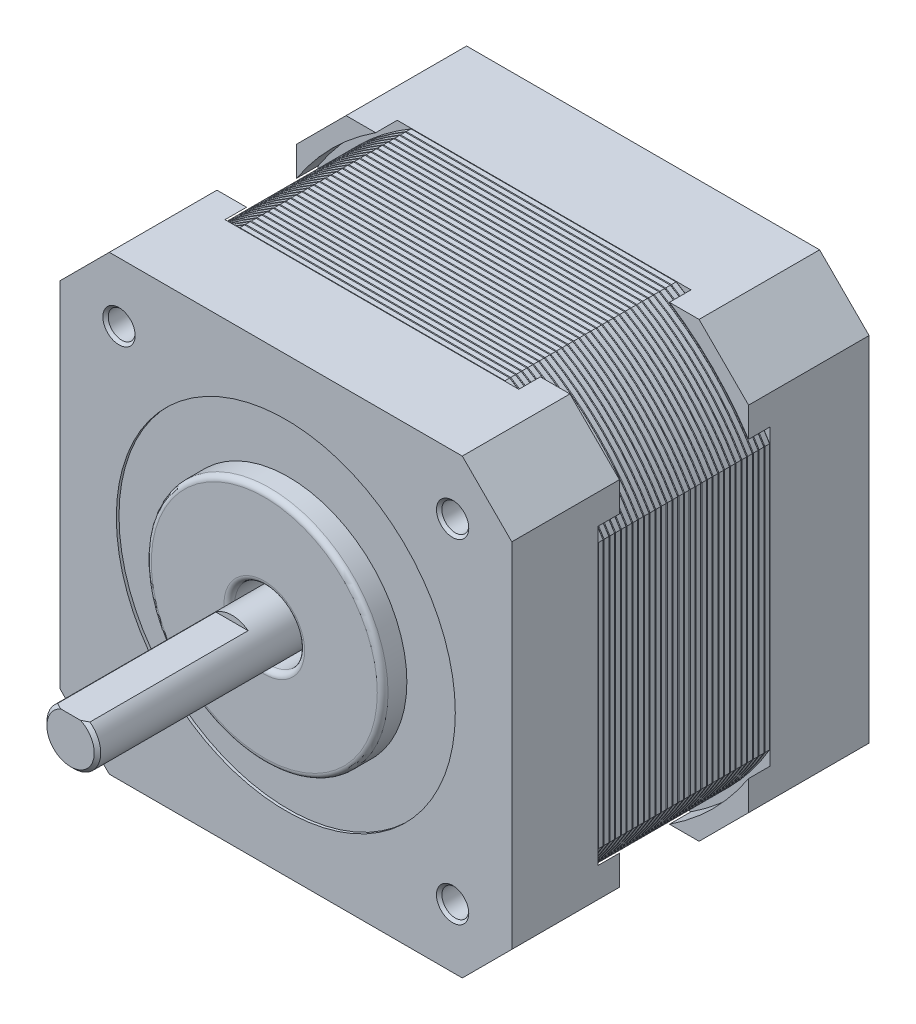
from build123d import *

# Parameters (mm, degrees)
SKETCH1_W                      = 42
SKETCH1_H                      = 42
BOSS_EXTRUDE1_DEPTH            = 33.2
CHAMFER1_SIZE                  = 4.6
SKETCH2_R                      = 11
BOSS_EXTRUDE2_DEPTH            = 2
BOSS_EXTRUDE4_START            = -2
SKETCH3_R                      = 2.5
BOSS_EXTRUDE4_DEPTH            = 20
SKETCH3_2_R                    = 2.5
CUT_EXTRUDE3_DEPTH             = 2
SKETCH4_W                      = 3
SKETCH4_H                      = 1
CUT_EXTRUDE4_DEPTH             = 15
CHAMFER2_SIZE                  = 0.3
M3X0_5_TAPPED_HOLE1_AT_2_COUNT = 2
M3X0_5_TAPPED_HOLE1_AT_2_PITCH = 31
M3X0_5_TAPPED_HOLE1_AT_3_COUNT = 2
M3X0_5_TAPPED_HOLE1_AT_3_PITCH = 43.840620434
M3X0_5_TAPPED_HOLE1_AT_4_COUNT = 2
M3X0_5_TAPPED_HOLE1_AT_4_PITCH = 31
CUT_EXTRUDE5_START             = -0.25
SKETCH2_3_R                    = 15.75
SKETCH2_3_R_2                  = 11
CUT_EXTRUDE5_DEPTH             = 0.25
SKETCH3_3_R                    = 3.25
SKETCH3_3_R_2                  = 2.5
CUT_EXTRUDE_THIN1_DEPTH        = 6
FILLET1_R                      = 0.5
CUT_EXTRUDE6_DEPTH             = 6
CUT_EXTRUDE_THIN2_DEPTH        = 8
CUT_EXTRUDE7_START             = 16
SKETCH13_R                     = 24.545793616
CUT_EXTRUDE7_DEPTH             = 16
SKETCH14_R                     = 1.7
BOSS_EXTRUDE5_DEPTH            = 0.533333333
CHAMFER3_SIZE                  = 0.05
LPATTERN1_COUNT                = 30
LPATTERN1_PITCH                = 0.533333333
SKETCH16_W                     = 8
SKETCH16_H                     = 7
CUT_EXTRUDE8_DEPTH             = 3
SKETCH17_W                     = 7.6
SKETCH17_H                     = 6.6
SKETCH17_W_2                   = 5.6
SKETCH17_H_2                   = 4.6
EXTRUDE_THIN1_DEPTH            = 3


# Read off the part's stored shape, not the designer's step: CSK for M3 Flat Head Machine Screw2
with BuildPart() as part:
    # Sketch1 → Boss-Extrude1 (new body)
    with BuildSketch(Plane.XY):
        Rectangle(SKETCH1_W, SKETCH1_H)
    extrude(amount=-BOSS_EXTRUDE1_DEPTH)

    # Chamfer1
    chamfer1_edges = [part.edges().sort_by_distance(p)[0] for p in [
        (21, -21, -16.6),
        (-21, -21, -16.6),
        (-21, 21, -16.6),
        (21, 21, -16.6),
    ]]
    chamfer(chamfer1_edges, length=CHAMFER1_SIZE)

    # Sketch2 → Boss-Extrude2 (add)
    with BuildSketch(Plane.XY):
        Circle(SKETCH2_R)
    extrude(amount=BOSS_EXTRUDE2_DEPTH)

    # Sketch3<2> → Cut-Extrude3 (cut)
    with BuildSketch(Plane.XY.offset(2)):
        with Locations(Location((0, 0, 0), (0, 0, 180))):
            Circle(SKETCH3_2_R)
    extrude(amount=-CUT_EXTRUDE3_DEPTH, mode=Mode.SUBTRACT)

    # Sketch6 → M3x0.5 Tapped Hole1 (revolve, cut)
    with BuildSketch(Plane(origin=(-15.5, 15.5, 0), x_dir=(0, -1, 0), z_dir=(1, 0, 0))):
        Polygon((0, 0), (0, 8.251075774), (1.25, 7.5), (1.25, 0.25), (1.5, 0), align=None)
    m3x0_5_tapped_hole1 = revolve(axis=Axis((-15.5, 15.5, 6.35), (0, 0, -1)), mode=Mode.SUBTRACT)

    # M3x0.5 Tapped Hole1 at 2: M3x0.5 Tapped Hole1 ×2
    with Locations(*[(i * M3X0_5_TAPPED_HOLE1_AT_2_PITCH, 0, 0) for i in range(1, M3X0_5_TAPPED_HOLE1_AT_2_COUNT)]):
        add(m3x0_5_tapped_hole1, mode=Mode.SUBTRACT)

    # M3x0.5 Tapped Hole1 at 3: M3x0.5 Tapped Hole1 ×2
    with Locations(*[Vector(0.7071067811865475, -0.7071067811865476, 0) * (i * M3X0_5_TAPPED_HOLE1_AT_3_PITCH) for i in range(1, M3X0_5_TAPPED_HOLE1_AT_3_COUNT)]):
        add(m3x0_5_tapped_hole1, mode=Mode.SUBTRACT)

    # M3x0.5 Tapped Hole1 at 4: M3x0.5 Tapped Hole1 ×2
    with Locations(*[(0, -i * M3X0_5_TAPPED_HOLE1_AT_4_PITCH, 0) for i in range(1, M3X0_5_TAPPED_HOLE1_AT_4_COUNT)]):
        add(m3x0_5_tapped_hole1, mode=Mode.SUBTRACT)

    # Sketch2<3> → Cut-Extrude5 (cut)
    with BuildSketch(Plane.XY.offset(CUT_EXTRUDE5_START)):
        Circle(SKETCH2_3_R)
        Circle(SKETCH2_3_R_2, mode=Mode.SUBTRACT)
    extrude(amount=CUT_EXTRUDE5_DEPTH, mode=Mode.SUBTRACT)

    # Sketch3<3> → Cut-Extrude-Thin1 (cut)
    with BuildSketch(Plane.XY.offset(2)):
        Circle(SKETCH3_3_R)
        Circle(SKETCH3_3_R_2, mode=Mode.SUBTRACT)
    extrude(amount=-CUT_EXTRUDE_THIN1_DEPTH, mode=Mode.SUBTRACT)

    # Fillet1
    fillet1_edges = [part.edges().sort_by_distance(p)[0] for p in [
        (-11, 0, 2),
        (-3.25, 0, 2),
    ]]
    fillet(fillet1_edges, radius=FILLET1_R)

    # Sketch7 → Cut-Extrude6 (cut, symmetric)
    with BuildSketch(Plane.XY.offset(-16)):
        with BuildLine():
            Line((21, -12.708107029), (21, -21))
            Line((21, -21), (12.708107029, -21))
            ThreePointArc((12.708107029, -21), (17.356497116, -17.356497116), (21, -12.708107029))
        make_face()
        with BuildLine():
            Line((12.708107029, 21), (21, 21))
            Line((21, 21), (21, 12.708107029))
            ThreePointArc((21, 12.708107029), (17.356497116, 17.356497116), (12.708107029, 21))
        make_face()
        with BuildLine():
            Line((-12.708107029, -21), (-21, -21))
            Line((-21, -21), (-21, -12.708107029))
            ThreePointArc((-21, -12.708107029), (-17.356497116, -17.356497116), (-12.708107029, -21))
        make_face()
        with BuildLine():
            Line((-21, 12.708107029), (-21, 21))
            Line((-21, 21), (-12.708107029, 21))
            ThreePointArc((-12.708107029, 21), (-17.356497116, 17.356497116), (-21, 12.708107029))
        make_face()
    extrude(amount=CUT_EXTRUDE6_DEPTH, both=True, mode=Mode.SUBTRACT)

    # Sketch8 → Cut-Extrude-Thin2 (cut, symmetric)
    with BuildSketch(Plane.XY.offset(-16)):
        with BuildLine():
            ThreePointArc((12.708107029, -21), (17.356497116, -17.356497116), (21, -12.708107029))
            Line((21, -12.708107029), (21.427771869, -12.9669723))
            ThreePointArc((21.427771869, -12.9669723), (17.710050506, -17.710050506), (12.9669723, -21.427771869))
            Line((12.9669723, -21.427771869), (12.708107029, -21))
        make_face()
        with BuildLine():
            ThreePointArc((-21, -12.708107029), (-17.356497116, -17.356497116), (-12.708107029, -21))
            Line((-12.708107029, -21), (-12.9669723, -21.427771869))
            ThreePointArc((-12.9669723, -21.427771869), (-17.710050506, -17.710050506), (-21.427771869, -12.9669723))
            Line((-21.427771869, -12.9669723), (-21, -12.708107029))
        make_face()
        with BuildLine():
            ThreePointArc((-12.708107029, 21), (-17.356497116, 17.356497116), (-21, 12.708107029))
            Line((-21, 12.708107029), (-21.427771869, 12.9669723))
            ThreePointArc((-21.427771869, 12.9669723), (-17.710050506, 17.710050506), (-12.9669723, 21.427771869))
            Line((-12.9669723, 21.427771869), (-12.708107029, 21))
        make_face()
        with BuildLine():
            ThreePointArc((21, 12.708107029), (17.356497116, 17.356497116), (12.708107029, 21))
            Line((12.708107029, 21), (12.9669723, 21.427771869))
            ThreePointArc((12.9669723, 21.427771869), (17.710050506, 17.710050506), (21.427771869, 12.9669723))
            Line((21.427771869, 12.9669723), (21, 12.708107029))
        make_face()
    extrude(amount=CUT_EXTRUDE_THIN2_DEPTH, both=True, mode=Mode.SUBTRACT)

    # CSK for M3 Flat Head Machine Screw2 outl → CSK for M3 Flat Head Machine Screw2 (revolve, cut)
    with BuildSketch(Plane(origin=(-15.5, -15.5, 0), x_dir=(1, 0, 0), z_dir=(0, -1, 0))):
        Polygon((1.7, -7.2), (1.25, -6.929612721), (1.25, -7.5), (0, -8.251075774), (0, -33.2), (3.15, -33.2), (1.7, -31.75), align=None)
    revolve(axis=Axis((-15.5, -15.5, 0), (0, 0, 1)), mode=Mode.SUBTRACT)

    # CSK for M3 Flat Head Machine Screw2 2 ou → CSK for M3 Flat Head Machine Screw2 2 (revolve, cut)
    with BuildSketch(Plane(origin=(15.5, -15.5, 0), x_dir=(1, 0, 0), z_dir=(0, -1, 0))):
        Polygon((1.7, -7.2), (1.25, -6.929612721), (1.25, -7.5), (0, -8.251075774), (0, -33.2), (3.15, -33.2), (1.7, -31.75), align=None)
    revolve(axis=Axis((15.5, -15.5, 0), (0, 0, 1)), mode=Mode.SUBTRACT)

    # CSK for M3 Flat Head Machine Screw2 3 ou → CSK for M3 Flat Head Machine Screw2 3 (revolve, cut)
    with BuildSketch(Plane(origin=(-15.5, 15.5, 0), x_dir=(1, 0, 0), z_dir=(0, -1, 0))):
        Polygon((1.7, -7.2), (1.25, -6.929612721), (1.25, -7.5), (0, -8.251075774), (0, -33.2), (3.15, -33.2), (1.7, -31.75), align=None)
    revolve(axis=Axis((-15.5, 15.5, 0), (0, 0, 1)), mode=Mode.SUBTRACT)

    # CSK for M3 Flat Head Machine Screw2 4 ou → CSK for M3 Flat Head Machine Screw2 4 (revolve, cut)
    with BuildSketch(Plane(origin=(15.5, 15.5, 0), x_dir=(1, 0, 0), z_dir=(0, -1, 0))):
        Polygon((1.7, -7.2), (1.25, -6.929612721), (1.25, -7.5), (0, -8.251075774), (0, -33.2), (3.15, -33.2), (1.7, -31.75), align=None)
    revolve(axis=Axis((15.5, 15.5, 0), (0, 0, 1)), mode=Mode.SUBTRACT)

    # Sketch13 → Cut-Extrude7 (cut)
    with BuildSketch(Plane.XY.offset(-24).offset(CUT_EXTRUDE7_START)):
        Circle(SKETCH13_R)
    extrude(amount=-CUT_EXTRUDE7_DEPTH, mode=Mode.SUBTRACT)


with BuildPart() as body_2:
    # Sketch3 → Boss-Extrude4 (new body)
    with BuildSketch(Plane.XY.offset(2).offset(BOSS_EXTRUDE4_START)):
        with Locations(Location((0, 0, 0), (0, 0, 180))):
            Circle(SKETCH3_R)
    extrude(amount=BOSS_EXTRUDE4_DEPTH)

    # Sketch4 → Cut-Extrude4 (cut)
    with BuildSketch(Plane.XY.offset(20)):
        with Locations((0, 2.5)):
            Rectangle(SKETCH4_W, SKETCH4_H)
    extrude(amount=-CUT_EXTRUDE4_DEPTH, mode=Mode.SUBTRACT)

    # Chamfer2
    chamfer2_edges = [body_2.edges().sort_by_distance(p)[0] for p in [
        (1.118033989, -2.236067977, 20),
    ]]
    chamfer(chamfer2_edges, length=CHAMFER2_SIZE)


with BuildPart() as cut_extrude7_piece_1:
    # of the separate pieces the step leaves, piece 1, a body of its own (cut_extrude7_pieces)
    add(part.part.solids().sort_by_distance((13.648874601, -21, -24))[0])

    # Sketch16 → Cut-Extrude8 (cut)
    with BuildSketch(Plane.XZ.offset(21)):
        with Locations((0, -27.5)):
            Rectangle(SKETCH16_W, SKETCH16_H)
    extrude(amount=-CUT_EXTRUDE8_DEPTH, mode=Mode.SUBTRACT)


with BuildPart() as cut_extrude7_piece_2:
    # of the separate pieces the step leaves, piece 2, a body of its own (cut_extrude7_pieces)
    add(part.part.solids().sort_by_distance((11, 0, 1.5))[0])


with BuildPart() as body_4:
    # Sketch14 → Boss-Extrude5 (new body)
    with BuildSketch(Plane.XY.offset(-24)):
        with BuildLine():
            Line((12.317372561, 21), (-12.317372561, 21))
            ThreePointArc((-12.317372561, 21), (-17.21507576, 17.21507576), (-21, 12.317372561))
            Line((-21, 12.317372561), (-21, -12.317372561))
            ThreePointArc((-21, -12.317372561), (-17.21507576, -17.21507576), (-12.317372561, -21))
            Line((-12.317372561, -21), (12.317372561, -21))
            ThreePointArc((12.317372561, -21), (17.21507576, -17.21507576), (21, -12.317372561))
            Line((21, -12.317372561), (21, 12.317372561))
            ThreePointArc((21, 12.317372561), (17.21507576, 17.21507576), (12.317372561, 21))
        make_face()
        with Locations((15.5, 15.5)):
            Circle(SKETCH14_R, mode=Mode.SUBTRACT)
        with Locations((-15.5, 15.5)):
            Circle(SKETCH14_R, mode=Mode.SUBTRACT)
        with Locations((15.5, -15.5)):
            Circle(SKETCH14_R, mode=Mode.SUBTRACT)
        with Locations((-15.5, -15.5)):
            Circle(SKETCH14_R, mode=Mode.SUBTRACT)
    extrude(amount=BOSS_EXTRUDE5_DEPTH)

    # Chamfer3
    chamfer3_edges = [body_4.edges().sort_by_distance(p)[0] for p in [
        (-17.21507576, -17.21507576, -23.466666667),
        (-21, 0, -24),
        (-17.21507576, 17.21507576, -24),
        (0, -21, -23.466666667),
        (17.21507576, -17.21507576, -23.466666667),
        (21, 0, -23.466666667),
        (13.8, 15.5, -24),
        (13.8, 15.5, -23.466666667),
        (17.21507576, 17.21507576, -23.466666667),
        (-17.2, 15.5, -24),
        (-17.2, 15.5, -23.466666667),
        (0, 21, -23.466666667),
        (13.8, -15.5, -24),
        (13.8, -15.5, -23.466666667),
        (-17.2, -15.5, -24),
        (-17.2, -15.5, -23.466666667),
        (-17.21507576, 17.21507576, -23.466666667),
        (-21, 0, -23.466666667),
        (0, 21, -24),
        (17.21507576, 17.21507576, -24),
        (21, 0, -24),
        (17.21507576, -17.21507576, -24),
        (0, -21, -24),
        (-17.21507576, -17.21507576, -24),
    ]]
    chamfer(chamfer3_edges, length=CHAMFER3_SIZE)


with BuildPart() as lpattern1_1:
    # LPattern1: pattern copy
    add(body_4.part.moved(Location(Vector(0, 0, 1) * (1 * LPATTERN1_PITCH))))


with BuildPart() as lpattern1_2:
    # LPattern1: pattern copy
    add(body_4.part.moved(Location(Vector(0, 0, 1) * (2 * LPATTERN1_PITCH))))


with BuildPart() as lpattern1_3:
    # LPattern1: pattern copy
    add(body_4.part.moved(Location(Vector(0, 0, 1) * (3 * LPATTERN1_PITCH))))


with BuildPart() as lpattern1_4:
    # LPattern1: pattern copy
    add(body_4.part.moved(Location(Vector(0, 0, 1) * (4 * LPATTERN1_PITCH))))


with BuildPart() as lpattern1_5:
    # LPattern1: pattern copy
    add(body_4.part.moved(Location(Vector(0, 0, 1) * (5 * LPATTERN1_PITCH))))


with BuildPart() as lpattern1_6:
    # LPattern1: pattern copy
    add(body_4.part.moved(Location(Vector(0, 0, 1) * (6 * LPATTERN1_PITCH))))


with BuildPart() as lpattern1_7:
    # LPattern1: pattern copy
    add(body_4.part.moved(Location(Vector(0, 0, 1) * (7 * LPATTERN1_PITCH))))


with BuildPart() as lpattern1_8:
    # LPattern1: pattern copy
    add(body_4.part.moved(Location(Vector(0, 0, 1) * (8 * LPATTERN1_PITCH))))


with BuildPart() as lpattern1_9:
    # LPattern1: pattern copy
    add(body_4.part.moved(Location(Vector(0, 0, 1) * (9 * LPATTERN1_PITCH))))


with BuildPart() as lpattern1_10:
    # LPattern1: pattern copy
    add(body_4.part.moved(Location(Vector(0, 0, 1) * (10 * LPATTERN1_PITCH))))


with BuildPart() as lpattern1_11:
    # LPattern1: pattern copy
    add(body_4.part.moved(Location(Vector(0, 0, 1) * (11 * LPATTERN1_PITCH))))


with BuildPart() as lpattern1_12:
    # LPattern1: pattern copy
    add(body_4.part.moved(Location(Vector(0, 0, 1) * (12 * LPATTERN1_PITCH))))


with BuildPart() as lpattern1_13:
    # LPattern1: pattern copy
    add(body_4.part.moved(Location(Vector(0, 0, 1) * (13 * LPATTERN1_PITCH))))


with BuildPart() as lpattern1_14:
    # LPattern1: pattern copy
    add(body_4.part.moved(Location(Vector(0, 0, 1) * (14 * LPATTERN1_PITCH))))


with BuildPart() as lpattern1_15:
    # LPattern1: pattern copy
    add(body_4.part.moved(Location(Vector(0, 0, 1) * (15 * LPATTERN1_PITCH))))


with BuildPart() as lpattern1_16:
    # LPattern1: pattern copy
    add(body_4.part.moved(Location(Vector(0, 0, 1) * (16 * LPATTERN1_PITCH))))


with BuildPart() as lpattern1_17:
    # LPattern1: pattern copy
    add(body_4.part.moved(Location(Vector(0, 0, 1) * (17 * LPATTERN1_PITCH))))


with BuildPart() as lpattern1_18:
    # LPattern1: pattern copy
    add(body_4.part.moved(Location(Vector(0, 0, 1) * (18 * LPATTERN1_PITCH))))


with BuildPart() as lpattern1_19:
    # LPattern1: pattern copy
    add(body_4.part.moved(Location(Vector(0, 0, 1) * (19 * LPATTERN1_PITCH))))


with BuildPart() as lpattern1_20:
    # LPattern1: pattern copy
    add(body_4.part.moved(Location(Vector(0, 0, 1) * (20 * LPATTERN1_PITCH))))


with BuildPart() as lpattern1_21:
    # LPattern1: pattern copy
    add(body_4.part.moved(Location(Vector(0, 0, 1) * (21 * LPATTERN1_PITCH))))


with BuildPart() as lpattern1_22:
    # LPattern1: pattern copy
    add(body_4.part.moved(Location(Vector(0, 0, 1) * (22 * LPATTERN1_PITCH))))


with BuildPart() as lpattern1_23:
    # LPattern1: pattern copy
    add(body_4.part.moved(Location(Vector(0, 0, 1) * (23 * LPATTERN1_PITCH))))


with BuildPart() as lpattern1_24:
    # LPattern1: pattern copy
    add(body_4.part.moved(Location(Vector(0, 0, 1) * (24 * LPATTERN1_PITCH))))


with BuildPart() as lpattern1_25:
    # LPattern1: pattern copy
    add(body_4.part.moved(Location(Vector(0, 0, 1) * (25 * LPATTERN1_PITCH))))


with BuildPart() as lpattern1_26:
    # LPattern1: pattern copy
    add(body_4.part.moved(Location(Vector(0, 0, 1) * (26 * LPATTERN1_PITCH))))


with BuildPart() as lpattern1_27:
    # LPattern1: pattern copy
    add(body_4.part.moved(Location(Vector(0, 0, 1) * (27 * LPATTERN1_PITCH))))


with BuildPart() as lpattern1_28:
    # LPattern1: pattern copy
    add(body_4.part.moved(Location(Vector(0, 0, 1) * (28 * LPATTERN1_PITCH))))


with BuildPart() as lpattern1_29:
    # LPattern1: pattern copy
    add(body_4.part.moved(Location(Vector(0, 0, 1) * (29 * LPATTERN1_PITCH))))


with BuildPart() as body_34:
    # Sketch17 → Extrude-Thin1 (new body)
    with BuildSketch(Plane.XZ.offset(18)):
        with Locations((0, -27.5)):
            Rectangle(SKETCH17_W, SKETCH17_H)
        with Locations((0, -27.5)):
            Rectangle(SKETCH17_W_2, SKETCH17_H_2, mode=Mode.SUBTRACT)
    extrude(amount=EXTRUDE_THIN1_DEPTH)


solid = Compound([body_2.part, cut_extrude7_piece_1.part, cut_extrude7_piece_2.part, body_4.part, lpattern1_1.part, lpattern1_2.part, lpattern1_3.part, lpattern1_4.part, lpattern1_5.part, lpattern1_6.part, lpattern1_7.part, lpattern1_8.part, lpattern1_9.part, lpattern1_10.part, lpattern1_11.part, lpattern1_12.part, lpattern1_13.part, lpattern1_14.part, lpattern1_15.part, lpattern1_16.part, lpattern1_17.part, lpattern1_18.part, lpattern1_19.part, lpattern1_20.part, lpattern1_21.part, lpattern1_22.part, lpattern1_23.part, lpattern1_24.part, lpattern1_25.part, lpattern1_26.part, lpattern1_27.part, lpattern1_28.part, lpattern1_29.part, body_34.part])
